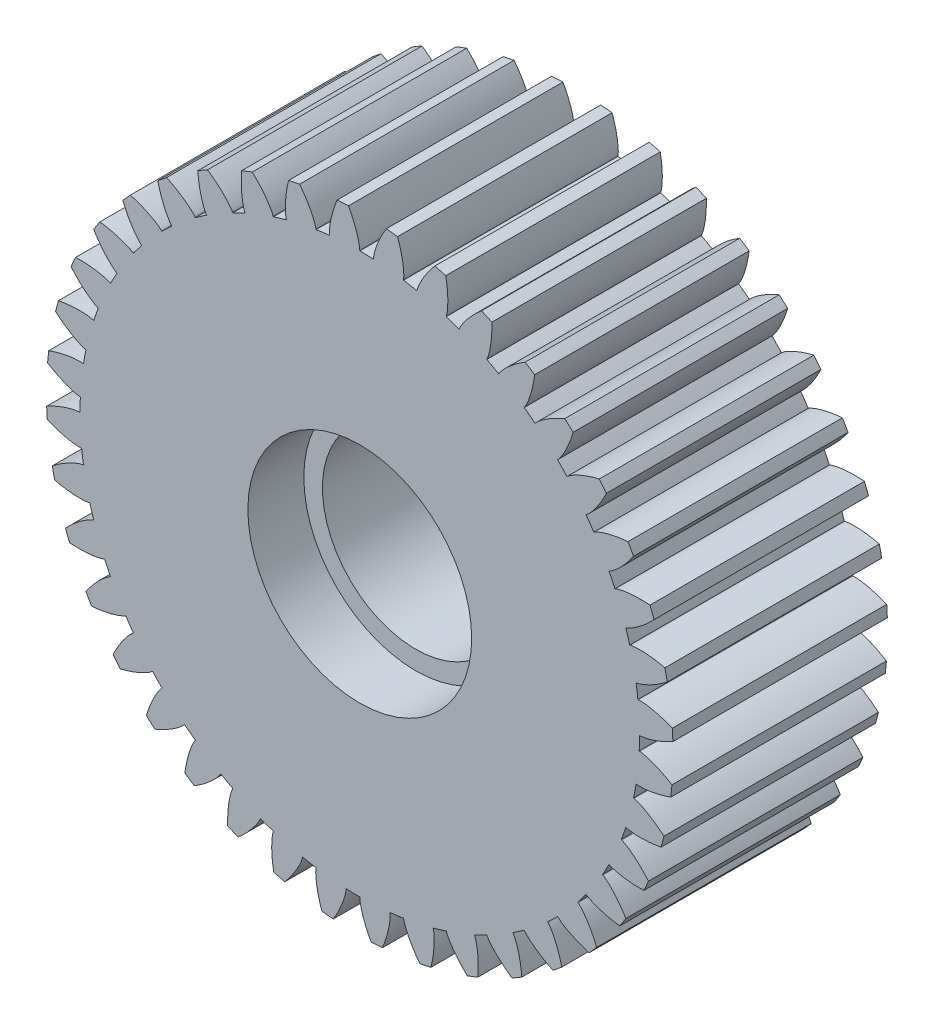
from build123d import *

# Parameters (mm, degrees)
SKETCH1_R           = 16.8
BOSS_EXTRUDE1_DEPTH = 5.75
CUT_EXTRUDE1_DEPTH  = 25.444682448
CIRPATTERN2_COUNT   = 40
SKETCH3_R           = 6
CUT_EXTRUDE2_DEPTH  = 3
SKETCH4_R           = 5
CUT_EXTRUDE3_DEPTH  = 26.218966504


with BuildPart() as part:
    # Sketch1 → Boss-Extrude1 (new, symmetric)
    with BuildSketch(Plane.XY):
        Circle(SKETCH1_R)
    extrude(amount=BOSS_EXTRUDE1_DEPTH, both=True)

    # Sketch2 → Cut-Extrude1 (cut, symmetric)
    with BuildSketch(Plane.XY):
        with BuildLine():
            add(Edge.make_bspline(
                [(15.035081933, 0), (15.040221733, 7.3946e-05), (15.054633976, 0.000510337), (15.081861635, 0.00223957), (15.126231687, 0.006344401), (15.182655981, 0.013458826), (15.255413256, 0.024814267), (15.340858298, 0.040963918), (15.434428668, 0.06160971), (15.535815124, 0.087189094), (15.636552924, 0.115457492), (15.736621163, 0.146206556), (15.835896984, 0.179132085), (15.955625758, 0.221715493), (16.098432415, 0.276524459), (16.264128992, 0.34601234), (16.450522903, 0.431199004), (16.606666321, 0.508850716), (16.713732646, 0.564918569), (16.77440889, 0.597709706), (16.789077746, 0.605696662)],
                knots=[0, 0, 0, 0, 0, 0.005376749, 0.015083688, 0.02853182, 0.04661014, 0.064854849, 0.092110525, 0.119476176, 0.146842496, 0.174208854, 0.201574956, 0.228941013, 0.256307345, 0.307035032, 0.361767352, 0.416499661, 0.471231937, 0.488701645, 0.488701645, 0.488701645, 0.488701645, 0.488701645], degree=4))
            Line((15.035081933, 0), (15, 0))
            ThreePointArc((15, 0), (14.995547629, -0.365446702), (14.982193161, -0.730676458))
            Line((14.982193161, -0.730676458), (15.017233447, -0.73238536))
            add(Edge.make_bspline(
                [(15.017233447, -0.73238536), (15.022363544, -0.732709587), (15.03673742, -0.733847506), (15.063848523, -0.736900994), (15.107965949, -0.743162295), (15.163976704, -0.753016801), (15.236094464, -0.767902897), (15.320651394, -0.788195555), (15.413104991, -0.813374816), (15.513125073, -0.843862547), (15.612366281, -0.877004503), (15.710817885, -0.912591564), (15.808371993, -0.950313907), (15.925884321, -0.998678963), (16.065851608, -1.060379228), (16.227966605, -1.137855991), (16.409989652, -1.232021104), (16.562165156, -1.317186656), (16.666373217, -1.378403339), (16.725380116, -1.414111196), (16.739642499, -1.422803216)],
                knots=[0, 0, 0, 0, 0, 0.005376749, 0.015083688, 0.02853182, 0.04661014, 0.064854849, 0.092110525, 0.119476176, 0.146842496, 0.174208854, 0.201574956, 0.228941013, 0.256307345, 0.307035032, 0.361767352, 0.416499661, 0.471231937, 0.488701645, 0.488701645, 0.488701645, 0.488701645, 0.488701645], degree=4))
            ThreePointArc((16.739642499, -1.422803216), (16.784903842, -0.712041435), (16.8, 0))
            ThreePointArc((16.8, 0), (16.797269215, 0.302897566), (16.789077746, 0.605696662))
        make_face()
    cut_extrude1 = extrude(amount=CUT_EXTRUDE1_DEPTH, both=True, mode=Mode.SUBTRACT)

    # CirPattern2: Cut-Extrude1 ×40 about axis
    cirpattern2_axis = Axis((0, 0, 5.75), (0, 0, -1))
    for i in range(1, CIRPATTERN2_COUNT):
        add(cut_extrude1.rotate(cirpattern2_axis, i * 360 / CIRPATTERN2_COUNT), mode=Mode.SUBTRACT)

    # Sketch3 → Cut-Extrude2 (cut)
    with BuildSketch(Plane.XY.offset(5.75)):
        Circle(SKETCH3_R)
    cut_extrude2 = extrude(amount=-CUT_EXTRUDE2_DEPTH, mode=Mode.SUBTRACT)

    # Sketch4 → Cut-Extrude3 (cut, through all)
    with BuildSketch(Plane.XY.offset(2.75)):
        Circle(SKETCH4_R)
    extrude(amount=-CUT_EXTRUDE3_DEPTH, mode=Mode.SUBTRACT)

    # Mirror1: Cut-Extrude2 across plane
    add(cut_extrude2.mirror(Plane.XY), mode=Mode.SUBTRACT)


solid = part.part
